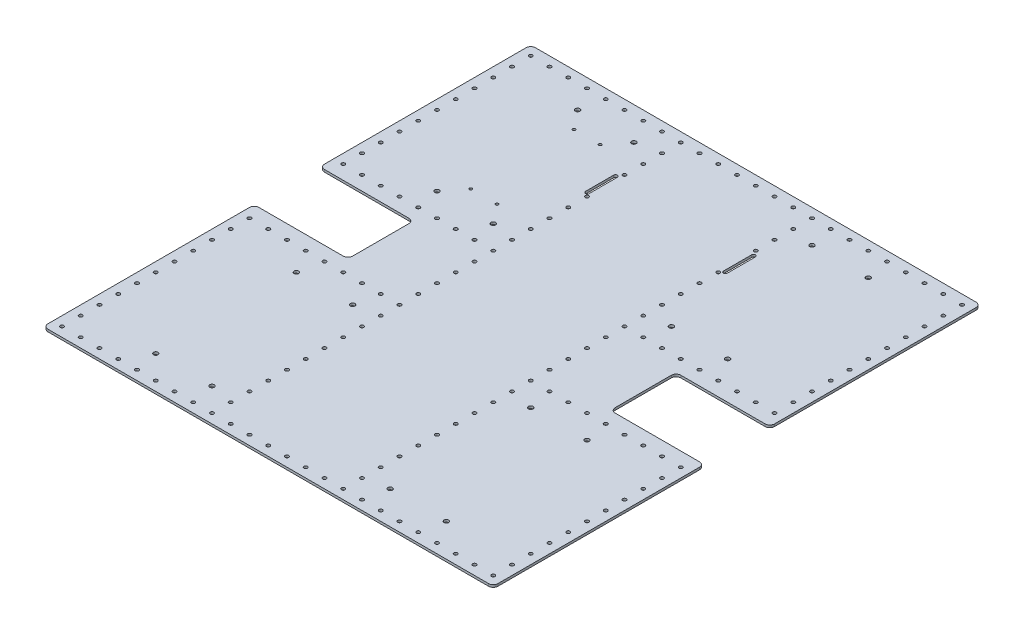
from build123d import *

# Parameters (mm, degrees)
BOSS_EXTRUDE1_DEPTH = 3.175
SKETCH2_R           = 2.4
CUT_EXTRUDE1_DEPTH  = 119.634
SKETCH3_R           = 2.425
CUT_EXTRUDE2_DEPTH  = 899.749353616
SKETCH3_3_R         = 2.425
CUT_EXTRUDE3_DEPTH  = 899.749353616
SKETCH4_R           = 3.100000023
SKETCH4_R_2         = 3.093357666
CUT_EXTRUDE4_DEPTH  = 899.749353616
FILLET1_R           = 6.35
SKETCH5_R           = 1.905
CUT_EXTRUDE5_DEPTH  = 899.749353616
CUT_EXTRUDE6_DEPTH  = 899.749353616
BOSS_EXTRUDE2_DEPTH = 3.175


with BuildPart() as part:
    # Sketch1 → Boss-Extrude1 (new body)
    with BuildSketch(Plane(origin=(0, 0, 0), x_dir=(1, 0, 0), z_dir=(0, 1, 0))):
        Polygon((609.6, 0), (0, 0), (0, -285.75), (127, -285.75), (127, -374.65), (0, -374.65), (0, -660.4), (609.6, -660.4), (609.6, -374.65), (482.6, -374.65), (482.6, -285.75), (609.6, -285.75), align=None)
    extrude(amount=BOSS_EXTRUDE1_DEPTH)

    # Sketch2 → Cut-Extrude1 (cut)
    with BuildSketch(Plane(origin=(0, 3.175, 0), x_dir=(1, 0, 0), z_dir=(0, 1, 0))):
        with Locations((12.7, -647.7)):
            Circle(SKETCH2_R)
        with Locations((38.1, -647.7)):
            Circle(SKETCH2_R)
        with Locations((63.5, -647.7)):
            Circle(SKETCH2_R)
        with Locations((88.9, -647.7)):
            Circle(SKETCH2_R)
        with Locations((114.3, -647.7)):
            Circle(SKETCH2_R)
        with Locations((139.7, -647.7)):
            Circle(SKETCH2_R)
        with Locations((165.1, -647.7)):
            Circle(SKETCH2_R)
        with Locations((190.5, -647.7)):
            Circle(SKETCH2_R)
        with Locations((215.9, -647.7)):
            Circle(SKETCH2_R)
        with Locations((241.3, -647.7)):
            Circle(SKETCH2_R)
        with Locations((266.7, -647.7)):
            Circle(SKETCH2_R)
        with Locations((292.1, -647.7)):
            Circle(SKETCH2_R)
        with Locations((317.5, -647.7)):
            Circle(SKETCH2_R)
        with Locations((342.9, -647.7)):
            Circle(SKETCH2_R)
        with Locations((368.3, -647.7)):
            Circle(SKETCH2_R)
        with Locations((393.7, -647.7)):
            Circle(SKETCH2_R)
        with Locations((419.1, -647.7)):
            Circle(SKETCH2_R)
        with Locations((444.5, -647.7)):
            Circle(SKETCH2_R)
        with Locations((469.9, -647.7)):
            Circle(SKETCH2_R)
        with Locations((495.3, -647.7)):
            Circle(SKETCH2_R)
        with Locations((520.7, -647.7)):
            Circle(SKETCH2_R)
        with Locations((546.1, -647.7)):
            Circle(SKETCH2_R)
        with Locations((571.5, -647.7)):
            Circle(SKETCH2_R)
        with Locations((596.9, -647.7)):
            Circle(SKETCH2_R)
        with Locations((12.7, -622.3)):
            Circle(SKETCH2_R)
        with Locations((12.7, -596.9)):
            Circle(SKETCH2_R)
        with Locations((12.7, -571.5)):
            Circle(SKETCH2_R)
        with Locations((12.7, -546.1)):
            Circle(SKETCH2_R)
        with Locations((12.7, -520.7)):
            Circle(SKETCH2_R)
        with Locations((12.7, -495.3)):
            Circle(SKETCH2_R)
        with Locations((12.7, -469.9)):
            Circle(SKETCH2_R)
        with Locations((12.7, -444.5)):
            Circle(SKETCH2_R)
        with Locations((12.7, -419.1)):
            Circle(SKETCH2_R)
        with Locations((12.7, -393.7)):
            Circle(SKETCH2_R)
        with Locations((596.9, -622.3)):
            Circle(SKETCH2_R)
        with Locations((596.9, -596.9)):
            Circle(SKETCH2_R)
        with Locations((596.9, -571.5)):
            Circle(SKETCH2_R)
        with Locations((596.9, -546.1)):
            Circle(SKETCH2_R)
        with Locations((596.9, -520.7)):
            Circle(SKETCH2_R)
        with Locations((596.9, -495.3)):
            Circle(SKETCH2_R)
        with Locations((596.9, -469.9)):
            Circle(SKETCH2_R)
        with Locations((596.9, -444.5)):
            Circle(SKETCH2_R)
        with Locations((596.9, -419.1)):
            Circle(SKETCH2_R)
        with Locations((596.9, -393.7)):
            Circle(SKETCH2_R)
        with Locations((215.9, -622.3)):
            Circle(SKETCH2_R)
        with Locations((393.7, -622.3)):
            Circle(SKETCH2_R)
        with Locations((215.9, -596.9)):
            Circle(SKETCH2_R)
        with Locations((393.7, -596.9)):
            Circle(SKETCH2_R)
        with Locations((215.9, -571.5)):
            Circle(SKETCH2_R)
        with Locations((393.7, -571.5)):
            Circle(SKETCH2_R)
        with Locations((215.9, -546.1)):
            Circle(SKETCH2_R)
        with Locations((393.7, -546.1)):
            Circle(SKETCH2_R)
        with Locations((215.9, -520.7)):
            Circle(SKETCH2_R)
        with Locations((393.7, -520.7)):
            Circle(SKETCH2_R)
        with Locations((215.9, -495.3)):
            Circle(SKETCH2_R)
        with Locations((393.7, -495.3)):
            Circle(SKETCH2_R)
        with Locations((215.9, -469.9)):
            Circle(SKETCH2_R)
        with Locations((393.7, -469.9)):
            Circle(SKETCH2_R)
        with Locations((215.9, -444.5)):
            Circle(SKETCH2_R)
        with Locations((393.7, -444.5)):
            Circle(SKETCH2_R)
        with Locations((215.9, -419.1)):
            Circle(SKETCH2_R)
        with Locations((393.7, -419.1)):
            Circle(SKETCH2_R)
        with Locations((215.9, -393.7)):
            Circle(SKETCH2_R)
        with Locations((393.7, -393.7)):
            Circle(SKETCH2_R)
        with Locations((215.9, -368.3)):
            Circle(SKETCH2_R)
        with Locations((393.7, -368.3)):
            Circle(SKETCH2_R)
        with Locations((215.9, -342.9)):
            Circle(SKETCH2_R)
        with Locations((393.7, -342.9)):
            Circle(SKETCH2_R)
        with Locations((215.9, -317.5)):
            Circle(SKETCH2_R)
        with Locations((393.7, -317.5)):
            Circle(SKETCH2_R)
        with Locations((215.9, -292.1)):
            Circle(SKETCH2_R)
        with Locations((393.7, -292.1)):
            Circle(SKETCH2_R)
        with Locations((215.9, -266.7)):
            Circle(SKETCH2_R)
        with Locations((393.7, -266.7)):
            Circle(SKETCH2_R)
        with Locations((215.9, -241.3)):
            Circle(SKETCH2_R)
        with Locations((393.7, -241.3)):
            Circle(SKETCH2_R)
        with Locations((215.9, -215.9)):
            Circle(SKETCH2_R)
        with Locations((393.7, -215.9)):
            Circle(SKETCH2_R)
        with Locations((215.9, -190.5)):
            Circle(SKETCH2_R)
        with Locations((393.7, -190.5)):
            Circle(SKETCH2_R)
        with Locations((215.9, -165.1)):
            Circle(SKETCH2_R)
        with Locations((393.7, -165.1)):
            Circle(SKETCH2_R)
        with Locations((215.9, -139.7)):
            Circle(SKETCH2_R)
        with Locations((393.7, -139.7)):
            Circle(SKETCH2_R)
        with Locations((215.9, -114.3)):
            Circle(SKETCH2_R)
        with Locations((393.7, -114.3)):
            Circle(SKETCH2_R)
        with Locations((215.9, -88.9)):
            Circle(SKETCH2_R)
        with Locations((393.7, -88.9)):
            Circle(SKETCH2_R)
        with Locations((215.9, -63.5)):
            Circle(SKETCH2_R)
        with Locations((393.7, -63.5)):
            Circle(SKETCH2_R)
        with Locations((215.9, -38.1)):
            Circle(SKETCH2_R)
        with Locations((393.7, -38.1)):
            Circle(SKETCH2_R)
        with Locations((215.9, -12.7)):
            Circle(SKETCH2_R)
        with Locations((393.7, -12.7)):
            Circle(SKETCH2_R)
        with Locations((12.7, -12.7)):
            Circle(SKETCH2_R)
        with Locations((38.1, -12.7)):
            Circle(SKETCH2_R)
        with Locations((63.5, -12.7)):
            Circle(SKETCH2_R)
        with Locations((88.9, -12.7)):
            Circle(SKETCH2_R)
        with Locations((114.3, -12.7)):
            Circle(SKETCH2_R)
        with Locations((139.7, -12.7)):
            Circle(SKETCH2_R)
        with Locations((165.1, -12.7)):
            Circle(SKETCH2_R)
        with Locations((190.5, -12.7)):
            Circle(SKETCH2_R)
        with Locations((241.3, -12.7)):
            Circle(SKETCH2_R)
        with Locations((266.7, -12.7)):
            Circle(SKETCH2_R)
        with Locations((292.1, -12.7)):
            Circle(SKETCH2_R)
        with Locations((317.5, -12.7)):
            Circle(SKETCH2_R)
        with Locations((342.9, -12.7)):
            Circle(SKETCH2_R)
        with Locations((368.3, -12.7)):
            Circle(SKETCH2_R)
        with Locations((419.1, -12.7)):
            Circle(SKETCH2_R)
        with Locations((444.5, -12.7)):
            Circle(SKETCH2_R)
        with Locations((469.9, -12.7)):
            Circle(SKETCH2_R)
        with Locations((495.3, -12.7)):
            Circle(SKETCH2_R)
        with Locations((520.7, -12.7)):
            Circle(SKETCH2_R)
        with Locations((546.1, -12.7)):
            Circle(SKETCH2_R)
        with Locations((571.5, -12.7)):
            Circle(SKETCH2_R)
        with Locations((596.9, -12.7)):
            Circle(SKETCH2_R)
        with Locations((12.7, -38.1)):
            Circle(SKETCH2_R)
        with Locations((12.7, -63.5)):
            Circle(SKETCH2_R)
        with Locations((12.7, -88.9)):
            Circle(SKETCH2_R)
        with Locations((12.7, -114.3)):
            Circle(SKETCH2_R)
        with Locations((12.7, -139.7)):
            Circle(SKETCH2_R)
        with Locations((12.7, -165.1)):
            Circle(SKETCH2_R)
        with Locations((12.7, -190.5)):
            Circle(SKETCH2_R)
        with Locations((12.7, -215.9)):
            Circle(SKETCH2_R)
        with Locations((12.7, -241.3)):
            Circle(SKETCH2_R)
        with Locations((12.7, -266.7)):
            Circle(SKETCH2_R)
        with Locations((596.9, -38.1)):
            Circle(SKETCH2_R)
        with Locations((596.9, -63.5)):
            Circle(SKETCH2_R)
        with Locations((596.9, -88.9)):
            Circle(SKETCH2_R)
        with Locations((596.9, -114.3)):
            Circle(SKETCH2_R)
        with Locations((596.9, -139.7)):
            Circle(SKETCH2_R)
        with Locations((596.9, -165.1)):
            Circle(SKETCH2_R)
        with Locations((596.9, -190.5)):
            Circle(SKETCH2_R)
        with Locations((596.9, -215.9)):
            Circle(SKETCH2_R)
        with Locations((596.9, -241.3)):
            Circle(SKETCH2_R)
        with Locations((596.9, -266.7)):
            Circle(SKETCH2_R)
    extrude(amount=-CUT_EXTRUDE1_DEPTH, mode=Mode.SUBTRACT)

    # Sketch3 → Cut-Extrude2 (cut, through all)
    with BuildSketch(Plane(origin=(0, 3.175, 0), x_dir=(1, 0, 0), z_dir=(0, 1, 0))):
        with Locations((571.5, -393.7)):
            Circle(SKETCH3_R)
        with Locations((38.1, -393.7)):
            Circle(SKETCH3_R)
        with Locations((63.5, -393.7)):
            Circle(SKETCH3_R)
        with Locations((88.9, -393.7)):
            Circle(SKETCH3_R)
        with Locations((114.3, -393.7)):
            Circle(SKETCH3_R)
        with Locations((139.7, -393.7)):
            Circle(SKETCH3_R)
        with Locations((165.1, -393.7)):
            Circle(SKETCH3_R)
        with Locations((190.5, -393.7)):
            Circle(SKETCH3_R)
        with Locations((419.1, -393.7)):
            Circle(SKETCH3_R)
        with Locations((444.5, -393.7)):
            Circle(SKETCH3_R)
        with Locations((469.9, -393.7)):
            Circle(SKETCH3_R)
        with Locations((495.3, -393.7)):
            Circle(SKETCH3_R)
        with Locations((520.7, -393.7)):
            Circle(SKETCH3_R)
        with Locations((546.1, -393.7)):
            Circle(SKETCH3_R)
    extrude(amount=-CUT_EXTRUDE2_DEPTH, mode=Mode.SUBTRACT)

    # Sketch3<3> → Cut-Extrude3 (cut, through all)
    with BuildSketch(Plane(origin=(0, 3.175, 0), x_dir=(1, 0, 0), z_dir=(0, 1, 0))):
        with Locations((63.5, -266.7)):
            Circle(SKETCH3_3_R)
        with Locations((38.1, -266.7)):
            Circle(SKETCH3_3_R)
        with Locations((88.9, -266.7)):
            Circle(SKETCH3_3_R)
        with Locations((114.3, -266.7)):
            Circle(SKETCH3_3_R)
        with Locations((139.7, -266.7)):
            Circle(SKETCH3_3_R)
        with Locations((165.1, -266.7)):
            Circle(SKETCH3_3_R)
        with Locations((190.5, -266.7)):
            Circle(SKETCH3_3_R)
        with Locations((419.1, -266.7)):
            Circle(SKETCH3_3_R)
        with Locations((444.5, -266.7)):
            Circle(SKETCH3_3_R)
        with Locations((469.9, -266.7)):
            Circle(SKETCH3_3_R)
        with Locations((495.3, -266.7)):
            Circle(SKETCH3_3_R)
        with Locations((520.7, -266.7)):
            Circle(SKETCH3_3_R)
        with Locations((571.5, -266.7)):
            Circle(SKETCH3_3_R)
        with Locations((546.1, -266.7)):
            Circle(SKETCH3_3_R)
    extrude(amount=-CUT_EXTRUDE3_DEPTH, mode=Mode.SUBTRACT)

    # Sketch4 → Cut-Extrude4 (cut, through all)
    with BuildSketch(Plane(origin=(0, 3.175, 0), x_dir=(1, 0, 0), z_dir=(0, 1, 0))):
        with Locations((425.45, -44.45)):
            Circle(SKETCH4_R)
        with Locations((501.65, -44.45)):
            Circle(SKETCH4_R)
        with Locations((425.45, -234.95)):
            Circle(SKETCH4_R)
        with Locations((501.65, -234.95)):
            Circle(SKETCH4_R_2)
        with Locations((107.95, -44.45)):
            Circle(SKETCH4_R)
        with Locations((107.95, -234.95)):
            Circle(SKETCH4_R_2)
        with Locations((184.15, -44.45)):
            Circle(SKETCH4_R)
        with Locations((184.15, -234.95)):
            Circle(SKETCH4_R)
        with Locations((107.95, -615.95)):
            Circle(SKETCH4_R)
        with Locations((184.15, -615.95)):
            Circle(SKETCH4_R)
        with Locations((107.95, -425.45)):
            Circle(SKETCH4_R_2)
        with Locations((184.15, -425.45)):
            Circle(SKETCH4_R)
        with Locations((501.65, -615.95)):
            Circle(SKETCH4_R)
        with Locations((501.65, -425.45)):
            Circle(SKETCH4_R_2)
        with Locations((425.45, -615.95)):
            Circle(SKETCH4_R)
        with Locations((425.45, -425.45)):
            Circle(SKETCH4_R)
    extrude(amount=-CUT_EXTRUDE4_DEPTH, mode=Mode.SUBTRACT)

    # Fillet1
    fillet1_edges = [part.edges().sort_by_distance(p)[0] for p in [
        (0, 1.5875, 285.75),
        (609.6, 1.5875, 0),
        (609.6, 1.5875, 285.75),
        (482.6, 1.5875, 285.75),
        (482.6, 1.5875, 374.65),
        (609.6, 1.5875, 374.65),
        (609.6, 1.5875, 660.4),
        (0, 1.5875, 660.4),
        (0, 1.5875, 374.65),
        (127, 1.5875, 374.65),
        (127, 1.5875, 285.75),
        (0, 1.5875, 0),
    ]]
    fillet(fillet1_edges, radius=FILLET1_R)

    # Sketch5 → Cut-Extrude5 (cut, through all)
    with BuildSketch(Plane(origin=(0, 3.175, 0), x_dir=(1, 0, 0), z_dir=(0, 1, 0))):
        with Locations((128.27, -69.85)):
            Circle(SKETCH5_R)
        with Locations((163.83, -69.85)):
            Circle(SKETCH5_R)
        with Locations((128.27, -209.55)):
            Circle(SKETCH5_R)
        with Locations((163.83, -209.55)):
            Circle(SKETCH5_R)
    extrude(amount=-CUT_EXTRUDE5_DEPTH, mode=Mode.SUBTRACT)

    # Sketch6 → Cut-Extrude6 (cut, through all)
    with BuildSketch(Plane(origin=(0, 3.175, 0), x_dir=(1, 0, 0), z_dir=(0, 1, 0))):
        with BuildLine():
            ThreePointArc((213.868, -96.52), (211.328, -93.98), (208.788, -96.52))
            Line((208.788, -96.52), (208.788, -134.62))
            ThreePointArc((208.788, -134.62), (211.328, -137.16), (213.868, -134.62))
            Line((213.868, -134.62), (213.868, -115.577096707))
            ThreePointArc((213.868, -115.577096707), (213.5, -114.3), (213.868, -113.022903293))
            Line((213.868, -113.022903293), (213.868, -96.52))
        make_face()
        with BuildLine():
            ThreePointArc((400.812, -96.52), (398.272, -93.98), (395.732, -96.52))
            Line((395.732, -96.52), (395.732, -113.022903293))
            ThreePointArc((395.732, -113.022903293), (396.1, -114.3), (395.732, -115.577096707))
            Line((395.732, -115.577096707), (395.732, -134.62))
            ThreePointArc((395.732, -134.62), (398.272, -137.16), (400.812, -134.62))
            Line((400.812, -134.62), (400.812, -96.52))
        make_face()
    extrude(amount=-CUT_EXTRUDE6_DEPTH, mode=Mode.SUBTRACT)

    # Sketch6<3> → Boss-Extrude2 (add)
    with BuildSketch(Plane(origin=(0, 3.175, 0), x_dir=(1, 0, 0), z_dir=(0, 1, 0))):
        with BuildLine():
            ThreePointArc((213.868, -115.577096707), (218.3, -114.3), (213.868, -113.022903293))
            Line((213.868, -113.022903293), (213.868, -115.577096707))
        make_face()
        with BuildLine():
            Line((395.732, -115.577096707), (395.732, -113.022903293))
            ThreePointArc((395.732, -113.022903293), (391.3, -114.3), (395.732, -115.577096707))
        make_face()
    extrude(amount=-BOSS_EXTRUDE2_DEPTH)


solid = part.part
